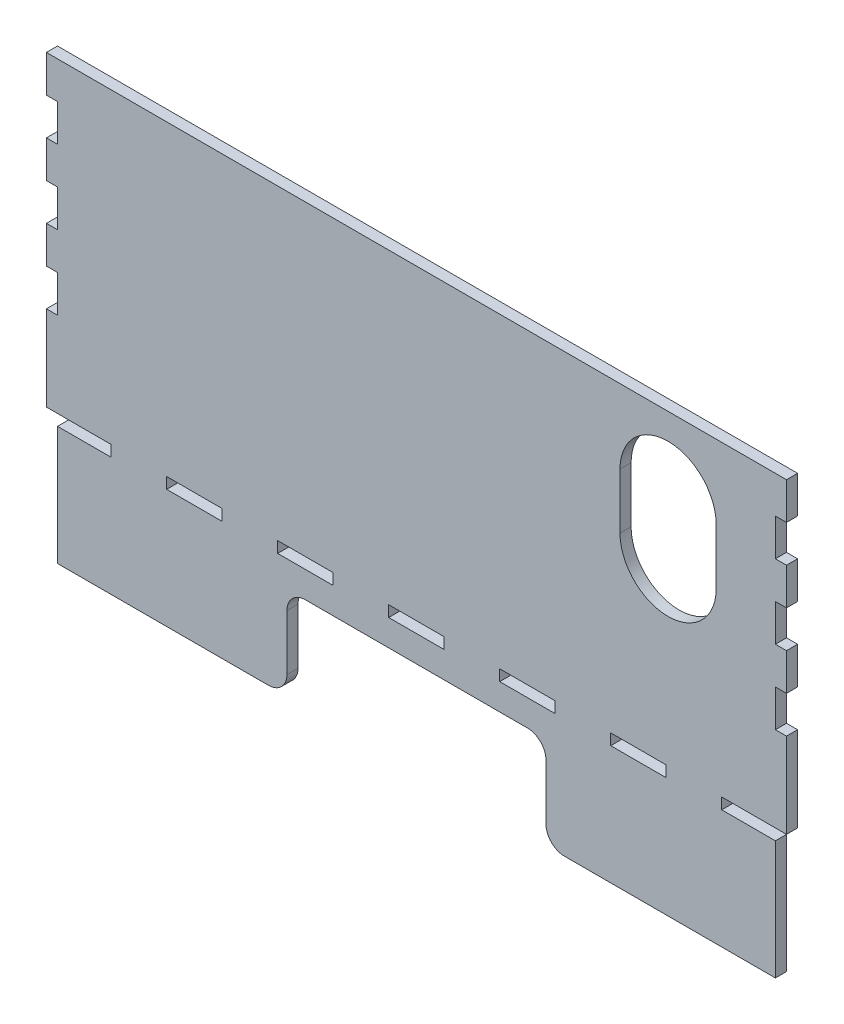
from build123d import *

# Parameters (mm, degrees)
BOSS_EXTRUDE1_DEPTH = 3
CUT_EXTRUDE1_DEPTH  = 10
SKETCH3_W           = 194
SKETCH3_H           = 3
BOSS_EXTRUDE2_DEPTH = 32.11
SKETCH4_W           = 70
SKETCH4_H           = 25
CUT_EXTRUDE2_DEPTH  = 22
FILLET1_R           = 5
FILLET2_R           = 5


with BuildPart() as part:
    # Sketch1 → Boss-Extrude1 (new body)
    with BuildSketch(Plane.XY):
        Polygon((100, -2.5), (97, -2.5), (97, 7.5), (100, 7.5), (100, 17.5), (97, 17.5), (97, 27.5), (100, 27.5), (100, 37.5), (97, 37.5), (97, 47.5), (100, 47.5), (100, 57.5), (97, 57.5), (-97, 57.5), (-100, 57.5), (-100, 47.5), (-97, 47.5), (-97, 37.5), (-100, 37.5), (-100, 27.5), (-97, 27.5), (-97, 17.5), (-100, 17.5), (-100, 7.5), (-97, 7.5), (-97, -2.5), (-100, -2.5), (-100, -25.5), (-97, -25.5), (-82.5, -25.5), (-82.5, -28.5), (-67.5, -28.5), (-67.5, -25.5), (-52.5, -25.5), (-52.5, -28.5), (-37.5, -28.5), (-37.5, -25.5), (-22.5, -25.5), (-22.5, -28.5), (-7.5, -28.5), (-7.5, -25.5), (0, -25.5), (7.5, -25.5), (7.5, -28.5), (22.5, -28.5), (22.5, -25.5), (30, -25.5), (37.5, -25.5), (37.5, -28.5), (52.5, -28.5), (52.5, -25.5), (60, -25.5), (67.5, -25.5), (67.5, -28.5), (82.5, -28.5), (82.5, -25.5), (97, -25.5), (100, -25.5), align=None)
    extrude(amount=BOSS_EXTRUDE1_DEPTH)

    # Sketch2 → Cut-Extrude1 (cut)
    with BuildSketch(Plane.XY.offset(3)):
        with BuildLine():
            Line((55, 22.5), (55, 37.5))
            ThreePointArc((55, 37.5), (68, 50.5), (81, 37.5))
            Line((81, 37.5), (81, 22.5))
            ThreePointArc((81, 22.5), (68, 9.5), (55, 22.5))
        make_face()
    extrude(amount=-CUT_EXTRUDE1_DEPTH, mode=Mode.SUBTRACT)

    # Sketch3 → Boss-Extrude2 (add)
    with BuildSketch(Plane.XZ.offset(28.5)):
        with Locations((0, 1.5)):
            Rectangle(SKETCH3_W, SKETCH3_H)
    extrude(amount=BOSS_EXTRUDE2_DEPTH)

    # Sketch4 → Cut-Extrude2 (cut)
    with BuildSketch(Plane.XY.offset(3)):
        with Locations((0, -48.11)):
            Rectangle(SKETCH4_W, SKETCH4_H)
    extrude(amount=-CUT_EXTRUDE2_DEPTH, mode=Mode.SUBTRACT)

    # Fillet1
    fillet1_edges = [part.edges().sort_by_distance(p)[0] for p in [
        (35, -60.61, 1.5),
        (-35, -60.61, 1.5),
    ]]
    fillet(fillet1_edges, radius=FILLET1_R)

    # Fillet2
    fillet2_edges = [part.edges().sort_by_distance(p)[0] for p in [
        (35, -35.61, 1.5),
        (-35, -35.61, 1.5),
    ]]
    fillet(fillet2_edges, radius=FILLET2_R)


solid = part.part
